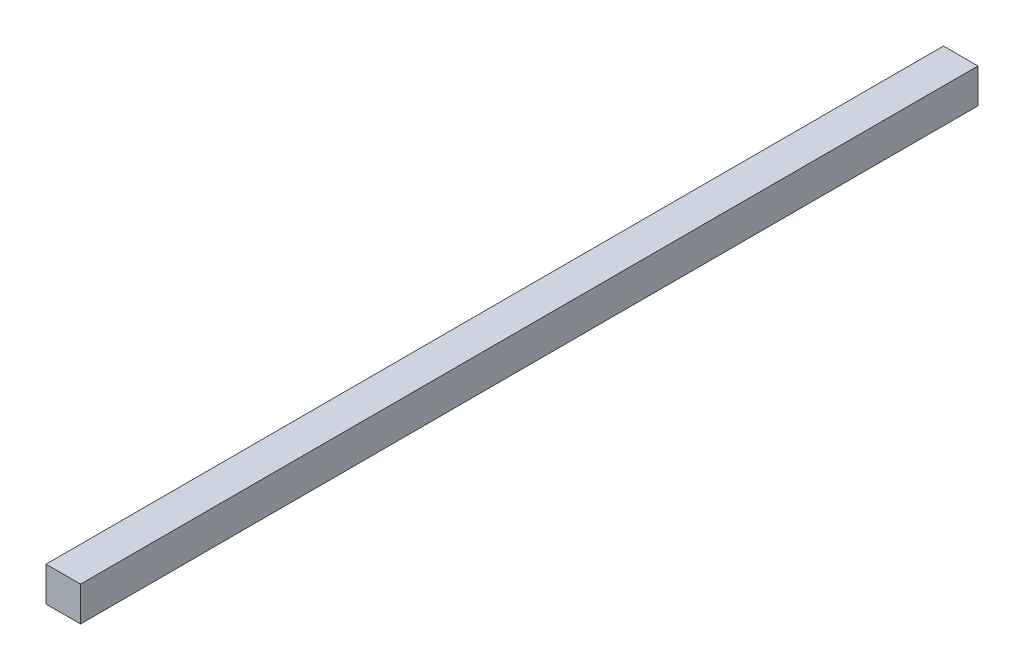
from build123d import *

# Parameters (mm, degrees)
SKETCH1_W           = 25.4
SKETCH1_H           = 25.4
BOSS_EXTRUDE1_DEPTH = 660.4


with BuildPart() as part:
    # Sketch1 → Boss-Extrude1 (new body)
    with BuildSketch(Plane.XY):
        Rectangle(SKETCH1_W, SKETCH1_H)
    extrude(amount=BOSS_EXTRUDE1_DEPTH)


solid = part.part
